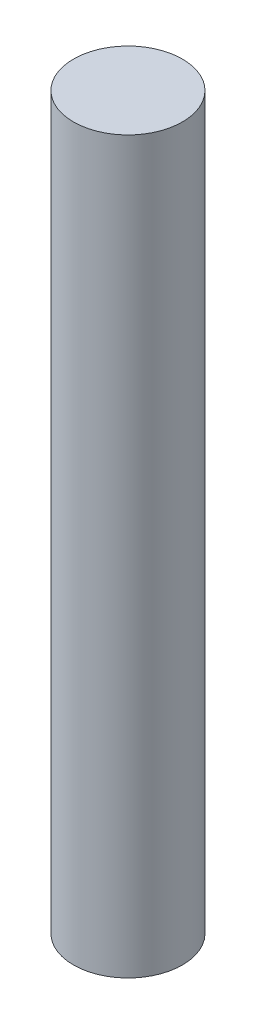
from build123d import *

# Parameters (mm, degrees)
SKETCH1_R           = 3.175
BOSS_EXTRUDE1_DEPTH = 42.545


with BuildPart() as part:
    # Sketch1 → Boss-Extrude1 (new body)
    with BuildSketch(Plane(origin=(0, 0, 0), x_dir=(1, 0, 0), z_dir=(0, 1, 0))):
        Circle(SKETCH1_R)
    extrude(amount=BOSS_EXTRUDE1_DEPTH)


solid = part.part
